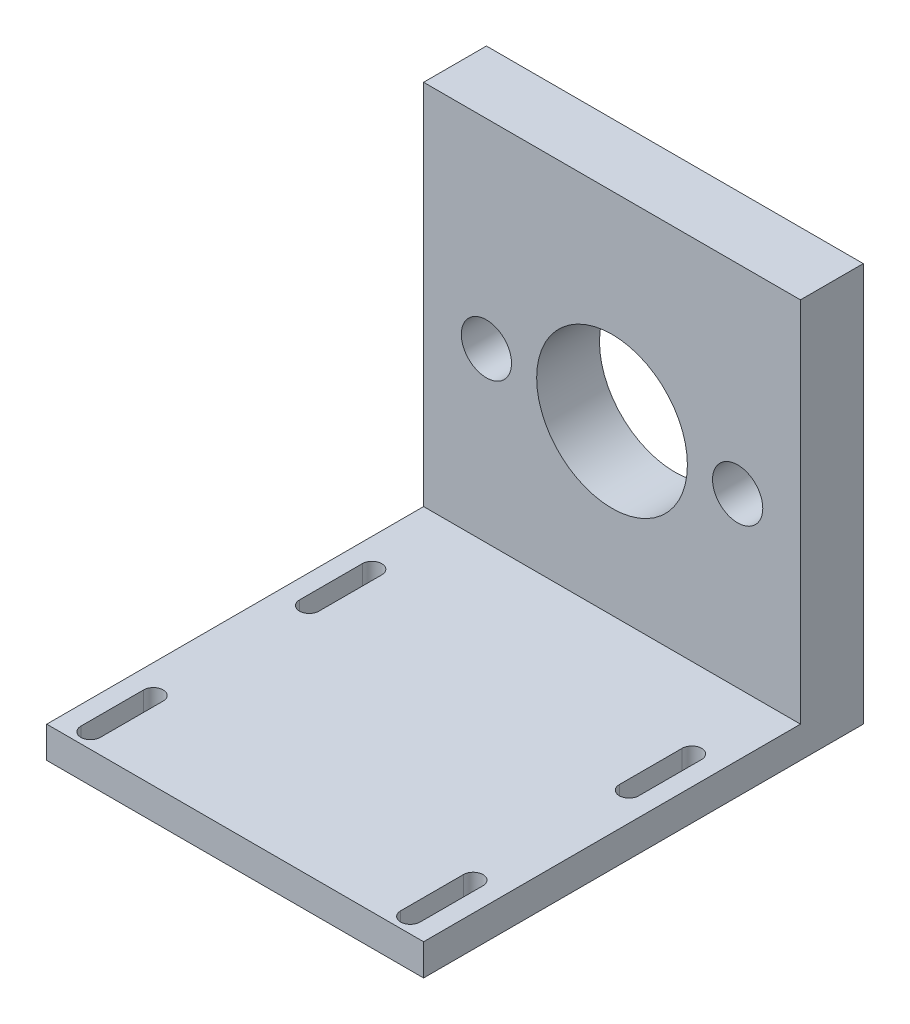
from build123d import *

# Parameters (mm, degrees)
SKETCH_1_W      = 60
SKETCH_1_H      = 63.5
SKETCH_1_R      = 12
SKETCH_1_R_2    = 4
EXTRUDE_1_DEPTH = 10
CHAMFER_1_SIZE  = 0.25
SKETCH_2_W      = 60
SKETCH_2_H      = 5
EXTRUDE_2_DEPTH = 60
MM_START        = -31.75
MM_1_DEPTH      = 5


# Read off the part's stored shape, not the designer's step: 大小mm 暗销槽口1
with BuildPart() as part:
    # 草图1 → 凸台-拉伸1 (new body)
    with BuildSketch(Plane.XY):
        Rectangle(SKETCH_1_W, SKETCH_1_H)
        Circle(SKETCH_1_R, mode=Mode.SUBTRACT)
        with Locations((20, 0)):
            Circle(SKETCH_1_R_2, mode=Mode.SUBTRACT)
        with Locations(Location((-20, 0, 0), (0, 0, 180))):
            Circle(SKETCH_1_R_2, mode=Mode.SUBTRACT)
    extrude(amount=EXTRUDE_1_DEPTH)

    # 倒角1
    chamfer_1_edges = [part.edges().sort_by_distance(p)[0] for p in [
        (16, 0, 0),
        (-16, 0, 0),
    ]]
    chamfer(chamfer_1_edges, length=CHAMFER_1_SIZE)

    # 草图2 → 凸台-拉伸2 (add)
    with BuildSketch(Plane.XY.offset(10)):
        with Locations((0, -29.25)):
            Rectangle(SKETCH_2_W, SKETCH_2_H)
    extrude(amount=EXTRUDE_2_DEPTH)

    # 大小mm 暗销槽口1 outline → 大小mm 暗销槽口1 (cut)
    with BuildSketch(Plane(origin=(0, 0, 0), x_dir=(1, 0, 0), z_dir=(0, 1, 0)).offset(MM_START)):
        with BuildLine():
            ThreePointArc((23.909259259, -32.749042146), (25.459259259, -34.299042146), (27.009259259, -32.749042146))
            Line((27.009259259, -32.749042146), (27.009259259, -22.749042146))
            ThreePointArc((27.009259259, -22.749042146), (25.459259259, -21.199042146), (23.909259259, -22.749042146))
            Line((23.909259259, -22.749042146), (23.909259259, -32.749042146))
        make_face()
        with BuildLine():
            Line((27.009259259, -67.557471264), (27.009259259, -57.557471264))
            ThreePointArc((27.009259259, -57.557471264), (25.459259259, -56.007471264), (23.909259259, -57.557471264))
            Line((23.909259259, -57.557471264), (23.909259259, -67.557471264))
            ThreePointArc((23.909259259, -67.557471264), (25.459259259, -69.107471264), (27.009259259, -67.557471264))
        make_face()
        with BuildLine():
            Line((-23.909259259, -67.557471264), (-23.909259259, -57.557471264))
            ThreePointArc((-23.909259259, -57.557471264), (-25.459259259, -56.007471264), (-27.009259259, -57.557471264))
            Line((-27.009259259, -57.557471264), (-27.009259259, -67.557471264))
            ThreePointArc((-27.009259259, -67.557471264), (-25.459259259, -69.107471264), (-23.909259259, -67.557471264))
        make_face()
        with BuildLine():
            Line((-23.909259259, -32.749042146), (-23.909259259, -22.749042146))
            ThreePointArc((-23.909259259, -22.749042146), (-25.459259259, -21.199042146), (-27.009259259, -22.749042146))
            Line((-27.009259259, -22.749042146), (-27.009259259, -32.749042146))
            ThreePointArc((-27.009259259, -32.749042146), (-25.459259259, -34.299042146), (-23.909259259, -32.749042146))
        make_face()
    extrude(amount=MM_1_DEPTH, mode=Mode.SUBTRACT)


solid = part.part
